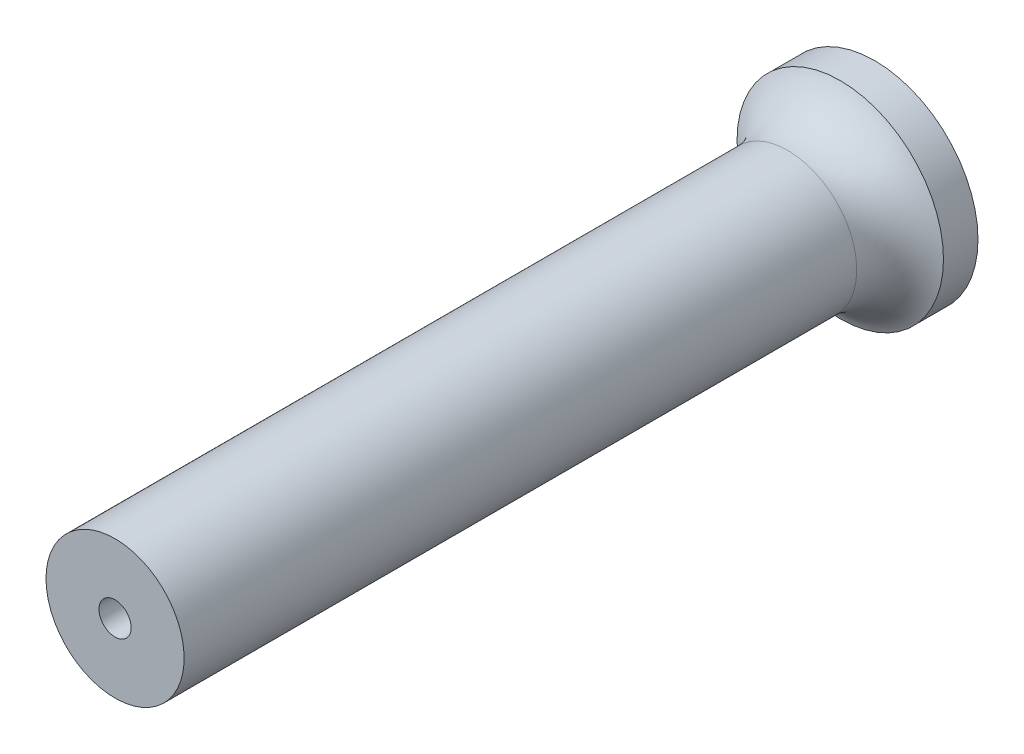
from build123d import *

# Parameters (mm, degrees)
SKETCH_1_R      = 8.966016308
SKETCH_1_R_2    = 1.4
EXTRUDE_1_DEPTH = 3
SKETCH_2_R      = 6
SKETCH_2_R_2    = 1.4
EXTRUDE_2_DEPTH = 66
FILLET_1_R      = 5


with BuildPart() as part:
    # Эскиз1 → Бобышка-Вытянуть1 (new body)
    with BuildSketch(Plane.XY):
        with Locations((150.771693647, 87.352480595)):
            Circle(SKETCH_1_R)
        with Locations((150.771693647, 87.352480595)):
            Circle(SKETCH_1_R_2, mode=Mode.SUBTRACT)
    extrude(amount=EXTRUDE_1_DEPTH)

    # Эскиз2 → Бобышка-Вытянуть2 (add)
    with BuildSketch(Plane(origin=(0, 0, 0), x_dir=(-1, 0, 0), z_dir=(0, 0, -1))):
        with Locations((-150.771693647, 87.352480595)):
            Circle(SKETCH_2_R)
        with Locations((-150.771693647, 87.352480595)):
            Circle(SKETCH_2_R_2, mode=Mode.SUBTRACT)
    extrude(amount=-EXTRUDE_2_DEPTH)

    # Скругление1
    # the kernel refuses this fillet: 5 mm, written as the material it adds along each edge
    with BuildSketch(Plane(origin=(150.771693647, 87.352480595, 3), x_dir=(-1, 0, 0), z_dir=(0, -1, 0))) as fillet_1_piece_1:
        with BuildLine():
            CenterArc((11, -4.567593495), FILLET_1_R, 114.00376912, 65.99623088)
            Line((6, -4.567593495), (5.9, -4.567593495))
            Line((5.9, -4.567593495), (5.9, 0))
            Line((5.9, 0), (6, 0.1))
            ThreePointArc((6, 0.1), (7.483008154, 0.1), (8.925336634, 0.09135187))
            Line((8.925336634, 0.09135187), (8.966016308, 0))
        make_face()
    revolve(axis=Axis((150.771693647, 87.352480595, 3), (0, 0, -1)))


solid = part.part
